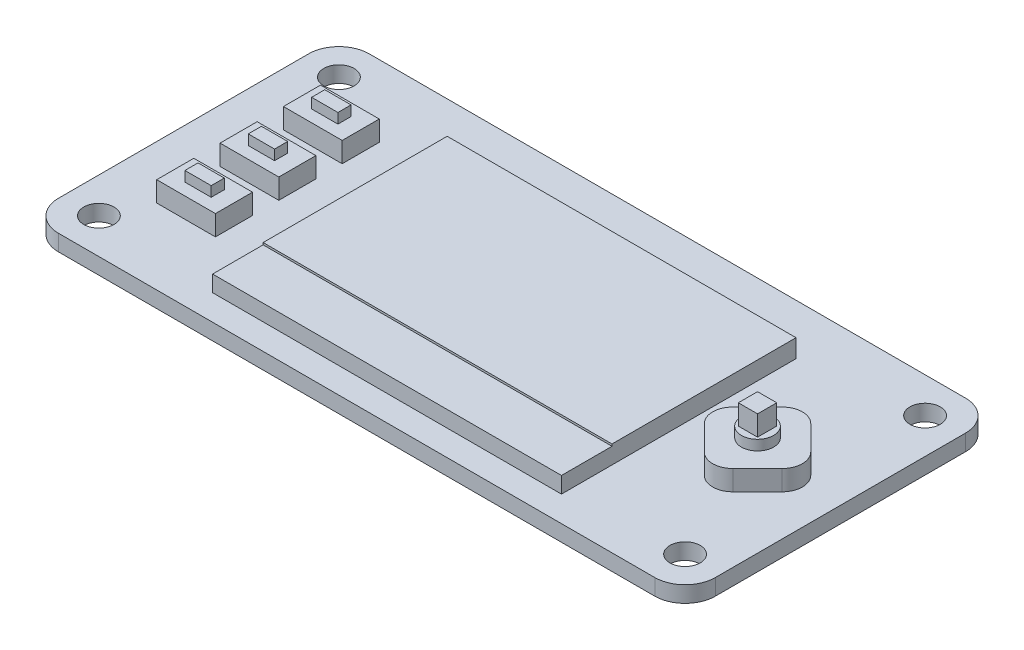
from build123d import *

# Parameters (mm, degrees)
EXTRUDE_1_DEPTH     = 1.6
SKETCH_2_R          = 1.5
CUT_EXTRUDE_1_DEPTH = 1.6
SKETCH_3_W          = 34.52
SKETCH_3_H          = 23.21
EXTRUDE_2_DEPTH     = 1.8
EXTRUDE_3_DEPTH     = 2
SKETCH_4_W          = 5.81
SKETCH_4_H          = 3.67
EXTRUDE_4_DEPTH     = 2
SKETCH_7_W          = 2.6
SKETCH_7_H          = 1.3
EXTRUDE_5_DEPTH     = 1
SKETCH_8_W          = 51
SKETCH_8_H          = 5
EXTRUDE_6_DEPTH     = 3.68
SKETCH_9_W          = 1.9
SKETCH_9_H          = 1.9
EXTRUDE_7_DEPTH     = 3
SKETCH_10_R         = 1.6
EXTRUDE_8_DEPTH     = 1
SKETCH_11_W         = 34.52
SKETCH_11_H         = 5
CUT_EXTRUDE_2_DEPTH = 0.2


with BuildPart() as part:
    # 草图1 → 凸台-拉伸1 (new body)
    with BuildSketch(Plane(origin=(0, 0, 0), x_dir=(1, 0, 0), z_dir=(0, 1, 0))):
        with BuildLine():
            Line((-29.5, 15.375), (29.5, 15.375))
            ThreePointArc((29.5, 15.375), (31.621320344, 14.496320344), (32.5, 12.375))
            Line((32.5, 12.375), (32.5, -12.375))
            ThreePointArc((32.5, -12.375), (31.621320344, -14.496320344), (29.5, -15.375))
            Line((29.5, -15.375), (-29.5, -15.375))
            ThreePointArc((-29.5, -15.375), (-31.621320344, -14.496320344), (-32.5, -12.375))
            Line((-32.5, -12.375), (-32.5, 12.375))
            ThreePointArc((-32.5, 12.375), (-31.621320344, 14.496320344), (-29.5, 15.375))
        make_face()
    extrude(amount=EXTRUDE_1_DEPTH)

    # 草图2 → 切除-拉伸1 (cut)
    with BuildSketch(Plane(origin=(0, 1.6, 0), x_dir=(1, 0, 0), z_dir=(0, 1, 0))):
        with Locations((-29, 11.875)):
            Circle(SKETCH_2_R)
        with Locations((-29, -11.875)):
            Circle(SKETCH_2_R)
        with Locations((29, -11.875)):
            Circle(SKETCH_2_R)
        with Locations((29, 11.875)):
            Circle(SKETCH_2_R)
    extrude(amount=-CUT_EXTRUDE_1_DEPTH, mode=Mode.SUBTRACT)

    # 草图3 → 凸台-拉伸2 (add)
    with BuildSketch(Plane(origin=(0, 1.6, 0), x_dir=(1, 0, 0), z_dir=(0, 1, 0))):
        with Locations((0.48, -1.24)):
            Rectangle(SKETCH_3_W, SKETCH_3_H)
    extrude(amount=EXTRUDE_2_DEPTH)

    # 草图5 → 凸台-拉伸3 (add)
    with BuildSketch(Plane(origin=(0, 1.6, 0), x_dir=(1, 0, 0), z_dir=(0, 1, 0))):
        with BuildLine():
            Line((26.024695167, 3.538250353), (28.464213562, 1.098731957))
            ThreePointArc((28.464213562, 1.098731957), (29.05, -0.315481605), (28.464213562, -1.729695167))
            Line((28.464213562, -1.729695167), (26.024695167, -4.169213562))
            ThreePointArc((26.024695167, -4.169213562), (24.610481605, -4.755), (23.196268043, -4.169213562))
            Line((23.196268043, -4.169213562), (20.756749647, -1.729695167))
            ThreePointArc((20.756749647, -1.729695167), (20.17096321, -0.315481605), (20.756749647, 1.098731957))
            Line((20.756749647, 1.098731957), (23.196268043, 3.538250353))
            ThreePointArc((23.196268043, 3.538250353), (24.610481605, 4.12403679), (26.024695167, 3.538250353))
        make_face()
    extrude(amount=EXTRUDE_3_DEPTH)

    # 草图4 → 凸台-拉伸4 (add)
    with BuildSketch(Plane(origin=(0, 1.6, 0), x_dir=(1, 0, 0), z_dir=(0, 1, 0))):
        with Locations((-24.325, 6.45)):
            Rectangle(SKETCH_4_W, SKETCH_4_H)
        with Locations((-24.325, 0.18)):
            Rectangle(SKETCH_4_W, SKETCH_4_H)
        with Locations((-24.325, -6.09)):
            Rectangle(SKETCH_4_W, SKETCH_4_H)
    extrude(amount=EXTRUDE_4_DEPTH)

    # 草图7 → 凸台-拉伸5 (add)
    with BuildSketch(Plane(origin=(0, 3.6, 0), x_dir=(1, 0, 0), z_dir=(0, 1, 0))):
        with Locations((-24.325, 6.45)):
            Rectangle(SKETCH_7_W, SKETCH_7_H)
        with Locations((-24.325, 0.18)):
            Rectangle(SKETCH_7_W, SKETCH_7_H)
        with Locations((-24.325, -6.09)):
            Rectangle(SKETCH_7_W, SKETCH_7_H)
    extrude(amount=EXTRUDE_5_DEPTH)

    # 草图8 → 凸台-拉伸6 (add)
    with BuildSketch(Plane.XZ):
        with Locations((-0.2, -11.235)):
            Rectangle(SKETCH_8_W, SKETCH_8_H)
    extrude(amount=EXTRUDE_6_DEPTH)

    # 草图9 → 凸台-拉伸7 (add)
    with BuildSketch(Plane(origin=(0, 3.6, 0), x_dir=(1, 0, 0), z_dir=(0, 1, 0))):
        with Locations((24.610481605, -0.315481605)):
            Rectangle(SKETCH_9_W, SKETCH_9_H)
    extrude(amount=EXTRUDE_7_DEPTH)

    # 草图10 → 凸台-拉伸8 (add)
    with BuildSketch(Plane(origin=(0, 3.6, 0), x_dir=(1, 0, 0), z_dir=(0, 1, 0))):
        with Locations((24.610481605, -0.315481605)):
            Circle(SKETCH_10_R)
    extrude(amount=EXTRUDE_8_DEPTH)

    # 草图11 → 切除-拉伸2 (cut)
    with BuildSketch(Plane(origin=(0, 3.4, 0), x_dir=(1, 0, 0), z_dir=(0, 1, 0))):
        with Locations((0.48, -10.345)):
            Rectangle(SKETCH_11_W, SKETCH_11_H)
    extrude(amount=-CUT_EXTRUDE_2_DEPTH, mode=Mode.SUBTRACT)


solid = part.part
